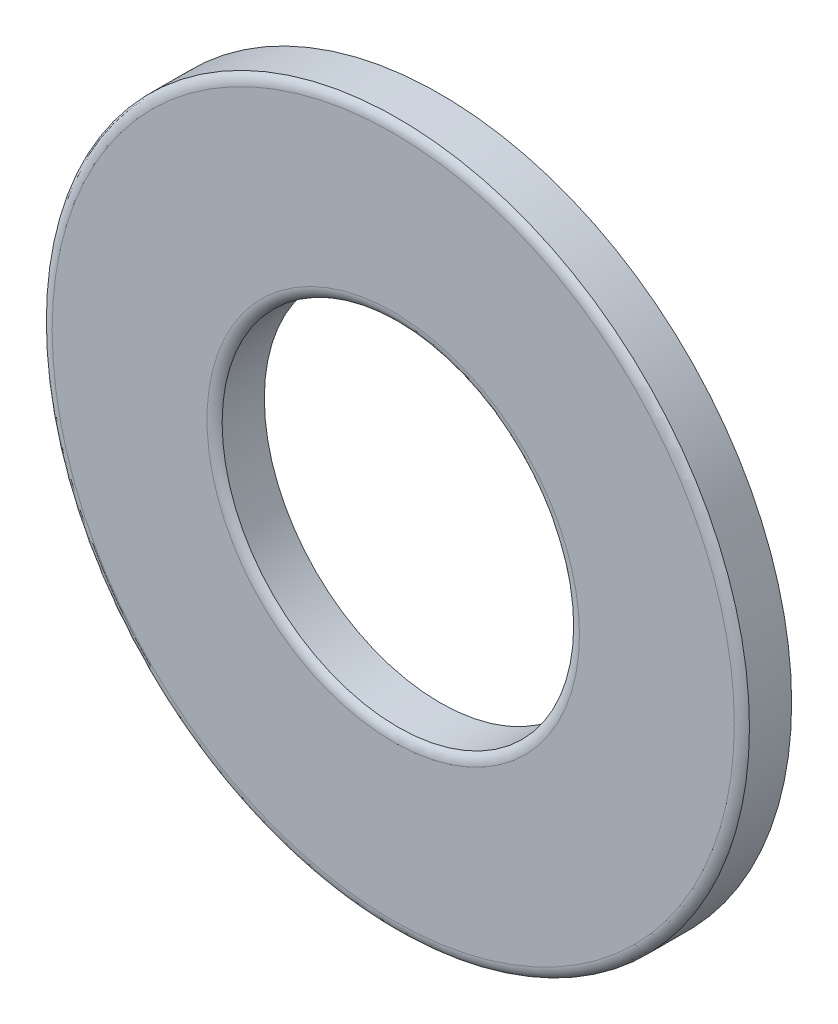
from build123d import *
from OCP.BRepFilletAPI import BRepFilletAPI_MakeChamfer

# Parameters (mm, degrees)
BOSS_EXTRUDE1_START = -0.635
SKETCH3_R           = 9.525
SKETCH3_R_2         = 4.7625
BOSS_EXTRUDE1_DEPTH = 1.27
CHAMFER1_SIZE       = 0.127
CHAMFER1_SIZE2      = 0.073323484
FILLET1_R           = 0.381


with BuildPart() as part:
    # Sketch3 → Boss-Extrude1 (new body)
    with BuildSketch(Plane.XY.offset(BOSS_EXTRUDE1_START)):
        Circle(SKETCH3_R)
        Circle(SKETCH3_R_2, mode=Mode.SUBTRACT)
    extrude(amount=BOSS_EXTRUDE1_DEPTH)

    # Chamfer1: one chamfer whose edges measure the first distance from different faces: ONE call of the kernel's chamfer builder (chamfer() names one face for all edges)
    chamfer1_edges_1 = [part.edges().sort_by_distance(p)[0] for p in [
        (-9.525, 0, 0.635),
    ]]
    chamfer1_side_1 = [part.faces().sort_by_distance(p)[0] for p in [
        (-9.525, 0, 0),
    ]]
    chamfer1_edges_2 = [part.edges().sort_by_distance(p)[0] for p in [
        (-4.7625, 0, 0.635),
    ]]
    chamfer1_side_2 = [part.faces().sort_by_distance(p)[0] for p in [
        (-4.7625, 0, 0),
    ]]
    chamfer1 = BRepFilletAPI_MakeChamfer(part.part.solid().wrapped)
    for e in chamfer1_edges_1:
        chamfer1.Add(CHAMFER1_SIZE, CHAMFER1_SIZE2, e.wrapped, chamfer1_side_1[0].wrapped)  # the first distance lies on this face
    for e in chamfer1_edges_2:
        chamfer1.Add(CHAMFER1_SIZE, CHAMFER1_SIZE2, e.wrapped, chamfer1_side_2[0].wrapped)  # the first distance lies on this face
    add(Compound.cast(chamfer1.Shape()), mode=Mode.REPLACE)

    # Fillet1
    # the kernel refuses this fillet: 0.381 mm, written as the material it takes off along each edge
    with BuildSketch(Plane(origin=(0, 0, 0.635), x_dir=(1, 0, 0), z_dir=(0, -1, 0))) as fillet1_piece_1:
        with BuildLine():
            CenterArc((9.241019367, -0.381), FILLET1_R, 41.810314896, 48.189685104)
            Line((9.241019367, 0), (9.241019367, 0.00762))
            Line((9.241019367, 0.00762), (9.451676516, 0.00762))
            Line((9.451676516, 0.00762), (9.458275629, 0.00381))
            ThreePointArc((9.458275629, 0.00381), (9.494937371, -0.05969), (9.530679613, -0.12192))
            Line((9.530679613, -0.12192), (9.525, -0.127))
        make_face()
    revolve(axis=Axis((0, 0, 0.635), (0, 0, 1)), mode=Mode.SUBTRACT)
    with BuildSketch(Plane(origin=(0, 0, 0.635), x_dir=(1, 0, 0), z_dir=(0, -1, 0))) as fillet1_piece_2:
        with BuildLine():
            CenterArc((5.046480633, -0.381), FILLET1_R, 90, 48.189685104)
            Line((4.7625, -0.127), (4.756820387, -0.12192))
            ThreePointArc((4.756820387, -0.12192), (4.792562629, -0.05969), (4.829224371, 0.00381))
            Line((4.829224371, 0.00381), (4.835823484, 0.00762))
            Line((4.835823484, 0.00762), (5.046480633, 0.00762))
            Line((5.046480633, 0.00762), (5.046480633, 0))
        make_face()
    revolve(axis=Axis((0, 0, 0.635), (0, 0, 1)), mode=Mode.SUBTRACT)


solid = part.part
